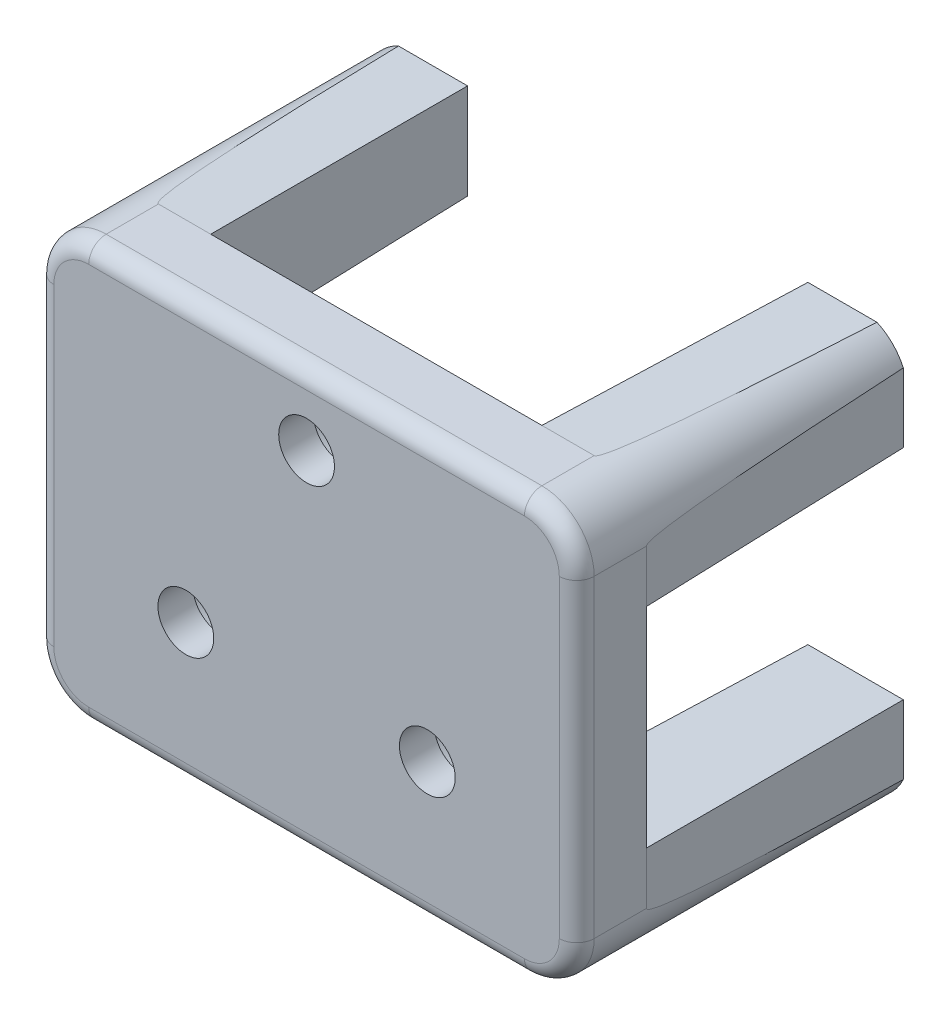
from build123d import *

# Parameters (mm, degrees)
SKETCH1_W                     = 6
SKETCH1_H                     = 6
BOSS_EXTRUDE1_DEPTH           = 4
SKETCH1_3_W                   = 6
SKETCH1_3_H                   = 6
BOSS_EXTRUDE2_DEPTH           = 15
BOSS_EXTRUDE2_DRAFT           = -1
BOSS_EXTRUDE2_PROFILE_2_DEPTH = 15
BOSS_EXTRUDE2_PROFILE_2_DRAFT = -1
BOSS_EXTRUDE2_PROFILE_3_DEPTH = 15
BOSS_EXTRUDE2_PROFILE_3_DRAFT = -1
BOSS_EXTRUDE2_PROFILE_4_DEPTH = 15
BOSS_EXTRUDE2_PROFILE_4_DRAFT = -1
SKETCH2_R                     = 1.6
CUT_EXTRUDE1_DEPTH            = 42.976183724
SKETCH3_R                     = 3
CUT_EXTRUDE2_DEPTH            = 2
FILLET1_R                     = 3
FILLET2_R                     = 1


with BuildPart() as part:
    # Sketch1 → Boss-Extrude1 (new body)
    with BuildSketch(Plane.XY):
        Polygon((6, 6), (6, 0), (25, 0), (25, 6), (31, 6), (31, 18), (25, 18), (25, 24), (6, 24), (6, 18), (0, 18), (0, 6), align=None)
        with Locations((3, 21)):
            Rectangle(SKETCH1_W, SKETCH1_H)
        with Locations((3, 3)):
            Rectangle(SKETCH1_W, SKETCH1_H)
        with Locations((28, 21)):
            Rectangle(SKETCH1_W, SKETCH1_H)
        with Locations((28, 3)):
            Rectangle(SKETCH1_W, SKETCH1_H)
    extrude(amount=BOSS_EXTRUDE1_DEPTH)


with BuildPart() as boss_extrude2_tool:
    # Sketch1<3> → Boss-Extrude2 (with draft: the straight prism first)
    with BuildSketch(Plane.XY):
        with Locations((3, 21)):
            Rectangle(SKETCH1_3_W, SKETCH1_3_H)
    extrude(amount=-BOSS_EXTRUDE2_DEPTH)
    # Boss-Extrude2: the draft: its side faces are tilted about the plane it starts from
    boss_extrude2_sides = [boss_extrude2_tool.faces().sort_by_distance(p)[0] for p in [
        (3, 24, -7.5),
        (0, 21, -7.5),
        (3, 18, -7.5),
        (6, 21, -7.5),
    ]]
    draft(boss_extrude2_sides, Plane.XY, BOSS_EXTRUDE2_DRAFT)


with BuildPart() as part_1:
    add(part.part)

    # Boss-Extrude2: add boss_extrude2_tool
    add(boss_extrude2_tool.part)


with BuildPart() as boss_extrude2_profile_2_tool:
    # Sketch1<3> → Boss-Extrude2 profile 2 (with draft: the straight prism first)
    with BuildSketch(Plane.XY):
        with Locations((28, 21)):
            Rectangle(SKETCH1_3_W, SKETCH1_3_H)
    extrude(amount=-BOSS_EXTRUDE2_PROFILE_2_DEPTH)
    # Boss-Extrude2 profile 2: the draft: its side faces are tilted about the plane it starts from
    boss_extrude2_profile_2_sides = [boss_extrude2_profile_2_tool.faces().sort_by_distance(p)[0] for p in [
        (28, 18, -7.5),
        (31, 21, -7.5),
        (28, 24, -7.5),
        (25, 21, -7.5),
    ]]
    draft(boss_extrude2_profile_2_sides, Plane.XY, BOSS_EXTRUDE2_PROFILE_2_DRAFT)


with BuildPart() as part_2:
    add(part_1.part)

    # Boss-Extrude2 profile 2: add boss_extrude2_profile_2_tool
    add(boss_extrude2_profile_2_tool.part)


with BuildPart() as boss_extrude2_profile_3_tool:
    # Sketch1<3> → Boss-Extrude2 profile 3 (with draft: the straight prism first)
    with BuildSketch(Plane.XY):
        with Locations((28, 3)):
            Rectangle(SKETCH1_3_W, SKETCH1_3_H)
    extrude(amount=-BOSS_EXTRUDE2_PROFILE_3_DEPTH)
    # Boss-Extrude2 profile 3: the draft: its side faces are tilted about the plane it starts from
    boss_extrude2_profile_3_sides = [boss_extrude2_profile_3_tool.faces().sort_by_distance(p)[0] for p in [
        (28, 0, -7.5),
        (31, 3, -7.5),
        (28, 6, -7.5),
        (25, 3, -7.5),
    ]]
    draft(boss_extrude2_profile_3_sides, Plane.XY, BOSS_EXTRUDE2_PROFILE_3_DRAFT)


with BuildPart() as part_3:
    add(part_2.part)

    # Boss-Extrude2 profile 3: add boss_extrude2_profile_3_tool
    add(boss_extrude2_profile_3_tool.part)


with BuildPart() as boss_extrude2_profile_4_tool:
    # Sketch1<3> → Boss-Extrude2 profile 4 (with draft: the straight prism first)
    with BuildSketch(Plane.XY):
        with Locations((3, 3)):
            Rectangle(SKETCH1_3_W, SKETCH1_3_H)
    extrude(amount=-BOSS_EXTRUDE2_PROFILE_4_DEPTH)
    # Boss-Extrude2 profile 4: the draft: its side faces are tilted about the plane it starts from
    boss_extrude2_profile_4_sides = [boss_extrude2_profile_4_tool.faces().sort_by_distance(p)[0] for p in [
        (0, 3, -7.5),
        (3, 0, -7.5),
        (6, 3, -7.5),
        (3, 6, -7.5),
    ]]
    draft(boss_extrude2_profile_4_sides, Plane.XY, BOSS_EXTRUDE2_PROFILE_4_DRAFT)


with BuildPart() as part_4:
    add(part_3.part)

    # Boss-Extrude2 profile 4: add boss_extrude2_profile_4_tool
    add(boss_extrude2_profile_4_tool.part)

    # Sketch2 → Cut-Extrude1 (cut, through all)
    with BuildSketch(Plane(origin=(0, 0, 0), x_dir=(-1, 0, 0), z_dir=(0, 0, -1))):
        with Locations((-22.42820323, 8)):
            Circle(SKETCH2_R)
        with Locations((-15.5, 20)):
            Circle(SKETCH2_R)
        with Locations((-8.57179677, 8)):
            Circle(SKETCH2_R)
    extrude(amount=-CUT_EXTRUDE1_DEPTH, mode=Mode.SUBTRACT)

    # Sketch3 → Cut-Extrude2 (cut)
    with BuildSketch(Plane(origin=(0, 0, 0), x_dir=(-1, 0, 0), z_dir=(0, 0, -1))):
        with Locations((-15.5, 20)):
            Circle(SKETCH3_R)
        with Locations((-8.57179677, 8)):
            Circle(SKETCH3_R)
        with Locations((-22.42820323, 8)):
            Circle(SKETCH3_R)
    extrude(amount=-CUT_EXTRUDE2_DEPTH, mode=Mode.SUBTRACT)

    # Fillet1
    # the kernel refuses this fillet: 3 mm, written as the material it takes off along each edge
    with BuildSketch(Plane(origin=(31, 24, -18), x_dir=(-1, 0, 0), z_dir=(0, 0, 1)), Plane(origin=(31, 0, -18), x_dir=(0, 1, 0), z_dir=(0, 0, 1))) as fillet1_piece_1:
        with BuildLine():
            CenterArc((FILLET1_R, FILLET1_R), FILLET1_R, 180, 90)
            Line((0, FILLET1_R), (-FILLET1_R * 0.02, FILLET1_R))
            Line((-FILLET1_R * 0.02, FILLET1_R), (-FILLET1_R * 0.02, -FILLET1_R * 0.02))
            Line((-FILLET1_R * 0.02, -FILLET1_R * 0.02), (FILLET1_R, -FILLET1_R * 0.02))
            Line((FILLET1_R, -FILLET1_R * 0.02), (FILLET1_R, 0))
        make_face()
    extrude(amount=40, mode=Mode.SUBTRACT)
    with BuildSketch(Plane(origin=(0, 0, -18), x_dir=(0, 1, 0), z_dir=(0, 0, 1)), Plane(origin=(0, 24, -18), x_dir=(1, 0, 0), z_dir=(0, 0, 1))) as fillet1_piece_2:
        with BuildLine():
            CenterArc((FILLET1_R, -FILLET1_R), FILLET1_R, 90, 90)
            Line((0, -FILLET1_R), (-FILLET1_R * 0.02, -FILLET1_R))
            Line((-FILLET1_R * 0.02, -FILLET1_R), (-FILLET1_R * 0.02, FILLET1_R * 0.02))
            Line((-FILLET1_R * 0.02, FILLET1_R * 0.02), (FILLET1_R, FILLET1_R * 0.02))
            Line((FILLET1_R, FILLET1_R * 0.02), (FILLET1_R, 0))
        make_face()
    extrude(amount=40, mode=Mode.SUBTRACT)

    # Fillet2
    fillet2_edges = [part_4.edges().sort_by_distance(p)[0] for p in [
        (15.5, 24, 4),
        (31, 12, 4),
        (0, 12, 4),
        (15.5, 0, 4),
        (0.878679656, 23.121320344, 4),
        (0.878679656, 0.878679656, 4),
        (30.121320344, 0.878679656, 4),
        (30.121320344, 23.121320344, 4),
    ]]
    fillet(fillet2_edges, radius=FILLET2_R)


solid = part_4.part
